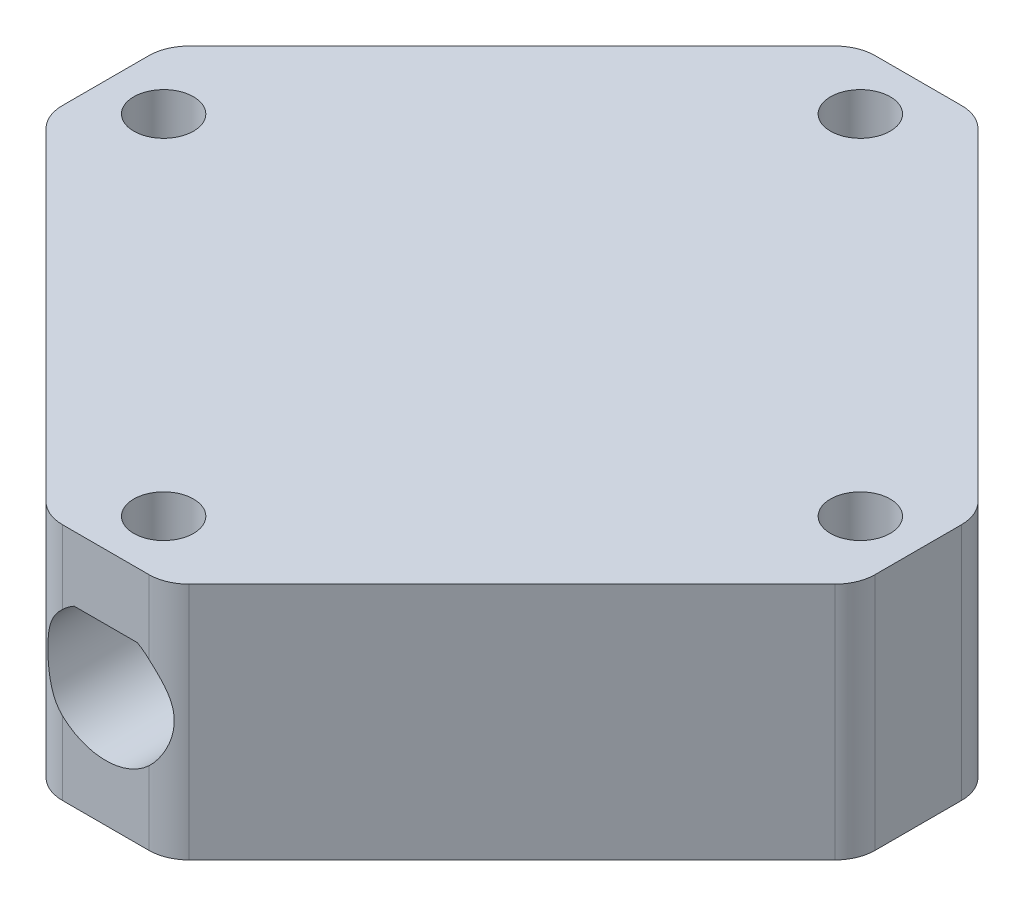
from build123d import *

# Parameters (mm, degrees)
BOSS_EXTRUDE1_DEPTH = 12
SKETCH3_R           = 1.5
CUT_EXTRUDE1_DEPTH  = 3
CUT_EXTRUDE2_DEPTH  = 25.4
FILLET1_R           = 2


with BuildPart() as part:
    # Sketch1 → Boss-Extrude1 (new body)
    with BuildSketch(Plane(origin=(0, 0, 0), x_dir=(1, 0, 0), z_dir=(0, 1, 0))):
        Polygon((-3, -20.41), (3, -20.41), (20.41, -3), (20.41, 3), (3, 20.41), (-3, 20.41), (-20.41, 3), (-20.41, -3), align=None)
    extrude(amount=BOSS_EXTRUDE1_DEPTH)

    # Sketch3 → Cut-Extrude1 (cut)
    with BuildSketch(Plane(origin=(0, 12, 0), x_dir=(1, 0, 0), z_dir=(0, 1, 0))):
        with Locations(Location((17.5, 0, 0), (0, 0, 270))):
            Circle(SKETCH3_R)
        with Locations(Location((0, -17.5, 0), (0, 0, 270))):
            Circle(SKETCH3_R)
        with Locations(Location((-17.5, 0, 0), (0, 0, 270))):
            Circle(SKETCH3_R)
        with Locations(Location((0, 17.5, 0), (0, 0, 270))):
            Circle(SKETCH3_R)
    extrude(amount=-CUT_EXTRUDE1_DEPTH, mode=Mode.SUBTRACT)

    # Sketch2 → Cut-Extrude2 (cut)
    with BuildSketch(Plane.XY.offset(20.41)):
        with BuildLine():
            Line((1.5875, 8.749630657), (-1.5875, 8.749630657))
            ThreePointArc((-1.5875, 8.749630657), (0, 2.825), (1.5875, 8.749630657))
        make_face()
    extrude(amount=-CUT_EXTRUDE2_DEPTH, mode=Mode.SUBTRACT)

    # Fillet1
    # the kernel refuses this fillet: 2 mm, written as the material it takes off along each edge
    with BuildSketch(Plane(origin=(20.41, -2.071067812, -3), x_dir=(0, 0, 1), z_dir=(0, 1, 0)), Plane(origin=(20.41, -2.071067812, 3), x_dir=(-0.7071067811865513, 0, 0.7071067811865438), z_dir=(0, 1, 0)), Plane(origin=(-20.41, -2.071067812, -3), x_dir=(0.7071067811865451, 0, -0.70710678118655), z_dir=(0, 1, 0)), Plane(origin=(-3, -2.071067812, -20.41), x_dir=(1, 0, 0), z_dir=(0, 1, 0)), Plane(origin=(3, -2.071067812, -20.41), x_dir=(0.7071067811865518, 0, 0.7071067811865432), z_dir=(0, 1, 0))) as fillet1_piece_1:
        with BuildLine():
            CenterArc((FILLET1_R * 0.414213562373, -FILLET1_R), FILLET1_R, 90, 45)
            Line((-FILLET1_R * 0.292893218813, -FILLET1_R * 0.292893218813), (0, 0))
            Line((0, 0), (FILLET1_R * 0.414213562373, 0))
        make_face()
    extrude(amount=16.142135624, mode=Mode.SUBTRACT)
    with BuildSketch(Plane(origin=(3, 4.968463332, 20.41), x_dir=(0.7071067811865491, 0, -0.7071067811865459), z_dir=(0, 1, 0)), Plane(origin=(-3, -2.071067812, 20.41), x_dir=(1, 0, 0), z_dir=(0, 1, 0))) as fillet1_piece_2:
        with BuildLine():
            CenterArc((FILLET1_R * 0.414213562373, FILLET1_R), FILLET1_R, 225, 45)
            Line((-FILLET1_R * 0.292893218813, FILLET1_R * 0.292893218813), (0, 0))
            Line((0, 0), (FILLET1_R * 0.414213562373, 0))
        make_face()
    extrude(amount=9.102604479, mode=Mode.SUBTRACT)
    with BuildSketch(Plane(origin=(-3, 4.968463332, 20.41), x_dir=(-0.7071067811865411, 0, -0.707106781186554), z_dir=(0, 1, 0)), Plane(origin=(3, -2.071067812, 20.41), x_dir=(-1, 0, 0), z_dir=(0, 1, 0))) as fillet1_piece_3:
        with BuildLine():
            CenterArc((FILLET1_R * 0.414213562373, -FILLET1_R), FILLET1_R, 90, 45)
            Line((-FILLET1_R * 0.292893218813, -FILLET1_R * 0.292893218813), (0, 0))
            Line((0, 0), (FILLET1_R * 0.414213562373, 0))
        make_face()
    extrude(amount=9.102604479, mode=Mode.SUBTRACT)
    with BuildSketch(Plane(origin=(-20.41, -2.071067812, 3), x_dir=(0.7071067811865429, 0, 0.7071067811865521), z_dir=(0, 1, 0))) as fillet1_piece_4:
        with BuildLine():
            CenterArc((FILLET1_R * 0.414213562373, FILLET1_R), FILLET1_R, 225, 45)
            Line((-FILLET1_R * 0.292893218813, FILLET1_R * 0.292893218813), (0, 0))
            Line((0, 0), (FILLET1_R * 0.414213562373, 0))
        make_face()
    extrude(amount=16.142135624, mode=Mode.SUBTRACT)


solid = part.part
